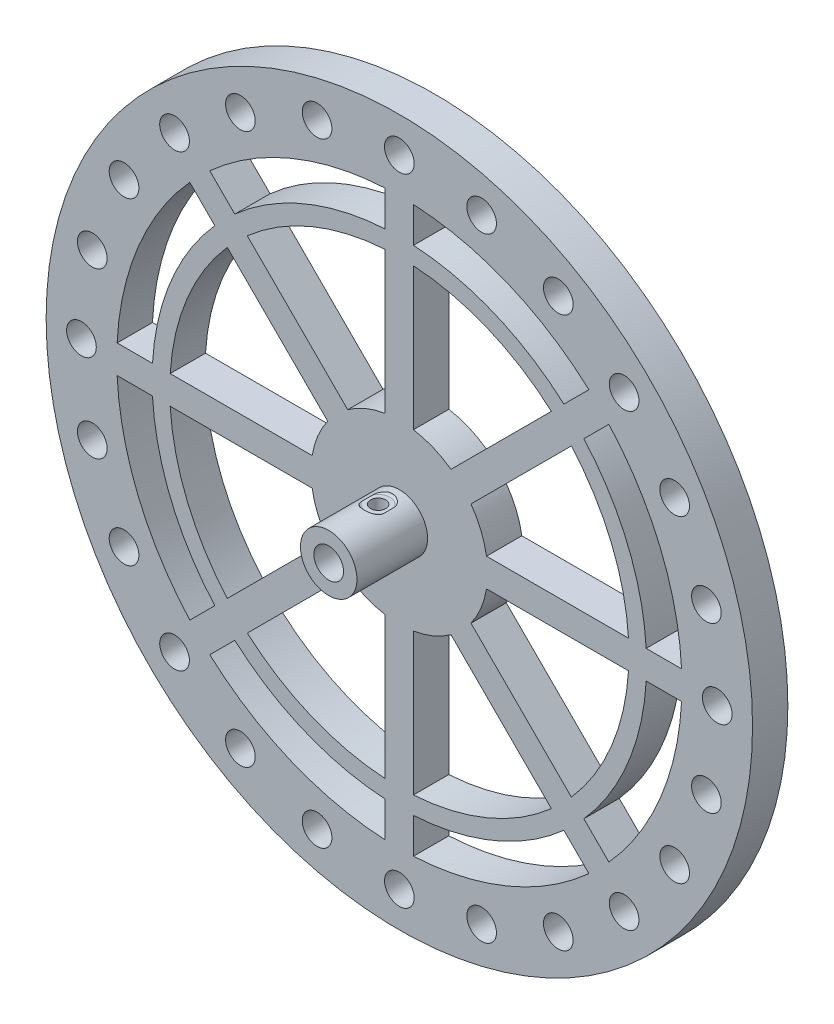
from build123d import *

# Parameters (mm, degrees)
SKETCH1_R            = 50
EXTRUDE2_DEPTH       = 2.5
EXTRUDE3_DEPTH       = 71.887234394
EXTRUDE3_DEPTH_BACK  = 71.887234394
SKETCH2_R            = 2.1
SKETCH3_R            = 4
EXTRUDE4_DEPTH       = 10
EXTRUDE5_REACH       = 74.284
SKETCH4_R            = 2.1
EXTRUDE6_REACH       = 76.648
EXTRUDE6_END_RADIUS  = 2.1
SKETCH5_R            = 1.075
SKETCH6_R            = 2
EXTRUDE7_DEPTH       = 0.3
FILLET1_R            = 0.3
FILLET1_OF_MIRROR2_R = 0.3


with BuildPart() as part:
    # Sketch1 → Extrude2 (new, symmetric)
    with BuildSketch(Plane.XY):
        Circle(SKETCH1_R)
        with BuildLine():
            Line((-2, 39.949968711), (-2, 34.942810419))
            ThreePointArc((-2, 34.942810419), (-13.393920133, 32.335783638), (-23.294084639, 26.122511764))
            Line((-23.294084639, 26.122511764), (-26.834680221, 29.663107346))
            ThreePointArc((-26.834680221, 29.663107346), (-15.307337295, 36.9551813), (-2, 39.949968711))
        make_face(mode=Mode.SUBTRACT)
        with BuildLine():
            Line((2, 34.942810419), (2, 39.949968711))
            ThreePointArc((2, 39.949968711), (15.307337295, 36.9551813), (26.834680221, 29.663107346))
            Line((26.834680221, 29.663107346), (23.294084639, 26.122511764))
            ThreePointArc((23.294084639, 26.122511764), (13.393920133, 32.335783638), (2, 34.942810419))
        make_face(mode=Mode.SUBTRACT)
        with BuildLine():
            Line((-29.663107346, 26.834680221), (-26.122511764, 23.294084639))
            ThreePointArc((-26.122511764, 23.294084639), (-32.335783638, 13.393920133), (-34.942810419, 2))
            Line((-34.942810419, 2), (-39.949968711, 2))
            ThreePointArc((-39.949968711, 2), (-36.9551813, 15.307337295), (-29.663107346, 26.834680221))
        make_face(mode=Mode.SUBTRACT)
        with BuildLine():
            Line((26.122511764, 23.294084639), (29.663107346, 26.834680221))
            ThreePointArc((29.663107346, 26.834680221), (36.9551813, 15.307337295), (39.949968711, 2))
            Line((39.949968711, 2), (34.942810419, 2))
            ThreePointArc((34.942810419, 2), (32.335783638, 13.393920133), (26.122511764, 23.294084639))
        make_face(mode=Mode.SUBTRACT)
        with BuildLine():
            Line((-39.949968711, -2), (-34.942810419, -2))
            ThreePointArc((-34.942810419, -2), (-32.335783638, -13.393920133), (-26.122511764, -23.294084639))
            Line((-26.122511764, -23.294084639), (-29.663107346, -26.834680221))
            ThreePointArc((-29.663107346, -26.834680221), (-36.9551813, -15.307337295), (-39.949968711, -2))
        make_face(mode=Mode.SUBTRACT)
        with BuildLine():
            Line((34.942810419, -2), (39.949968711, -2))
            ThreePointArc((39.949968711, -2), (36.9551813, -15.307337295), (29.663107346, -26.834680221))
            Line((29.663107346, -26.834680221), (26.122511764, -23.294084639))
            ThreePointArc((26.122511764, -23.294084639), (32.335783638, -13.393920133), (34.942810419, -2))
        make_face(mode=Mode.SUBTRACT)
        with BuildLine():
            Line((-26.834680221, -29.663107346), (-23.294084639, -26.122511764))
            ThreePointArc((-23.294084639, -26.122511764), (-13.393920133, -32.335783638), (-2, -34.942810419))
            Line((-2, -34.942810419), (-2, -39.949968711))
            ThreePointArc((-2, -39.949968711), (-15.307337295, -36.9551813), (-26.834680221, -29.663107346))
        make_face(mode=Mode.SUBTRACT)
        with BuildLine():
            Line((23.294084639, -26.122511764), (26.834680221, -29.663107346))
            ThreePointArc((26.834680221, -29.663107346), (15.307337295, -36.9551813), (2, -39.949968711))
            Line((2, -39.949968711), (2, -34.942810419))
            ThreePointArc((2, -34.942810419), (13.393920133, -32.335783638), (23.294084639, -26.122511764))
        make_face(mode=Mode.SUBTRACT)
        with BuildLine():
            ThreePointArc((-7.310750621, -10.139177746), (-4.783542905, -11.548494156), (-2, -12.338962679))
            Line((-2, -12.338962679), (-2, -32.438403167))
            ThreePointArc((-2, -32.438403167), (-12.437211552, -30.026084807), (-21.523201288, -24.351628412))
            Line((-21.523201288, -24.351628412), (-7.310750621, -10.139177746))
        make_face(mode=Mode.SUBTRACT)
        with BuildLine():
            ThreePointArc((-12.338962679, -2), (-11.548494156, -4.783542905), (-10.139177746, -7.310750621))
            Line((-10.139177746, -7.310750621), (-24.351628412, -21.523201288))
            ThreePointArc((-24.351628412, -21.523201288), (-30.026084807, -12.437211552), (-32.438403167, -2))
            Line((-32.438403167, -2), (-12.338962679, -2))
        make_face(mode=Mode.SUBTRACT)
        with BuildLine():
            ThreePointArc((21.523201288, -24.351628412), (12.437211552, -30.026084807), (2, -32.438403167))
            Line((2, -32.438403167), (2, -12.338962679))
            ThreePointArc((2, -12.338962679), (4.783542905, -11.548494156), (7.310750621, -10.139177746))
            Line((7.310750621, -10.139177746), (21.523201288, -24.351628412))
        make_face(mode=Mode.SUBTRACT)
        with BuildLine():
            ThreePointArc((32.438403167, -2), (30.026084807, -12.437211552), (24.351628412, -21.523201288))
            Line((24.351628412, -21.523201288), (10.139177746, -7.310750621))
            ThreePointArc((10.139177746, -7.310750621), (11.548494156, -4.783542905), (12.338962679, -2))
            Line((12.338962679, -2), (32.438403167, -2))
        make_face(mode=Mode.SUBTRACT)
        with BuildLine():
            ThreePointArc((-10.139177746, 7.310750621), (-11.548494156, 4.783542905), (-12.338962679, 2))
            Line((-12.338962679, 2), (-32.438403167, 2))
            ThreePointArc((-32.438403167, 2), (-30.026084807, 12.437211552), (-24.351628412, 21.523201288))
            Line((-24.351628412, 21.523201288), (-10.139177746, 7.310750621))
        make_face(mode=Mode.SUBTRACT)
        with BuildLine():
            ThreePointArc((-2, 12.338962679), (-4.783542905, 11.548494156), (-7.310750621, 10.139177746))
            Line((-7.310750621, 10.139177746), (-21.523201288, 24.351628412))
            ThreePointArc((-21.523201288, 24.351628412), (-12.437211552, 30.026084807), (-2, 32.438403167))
            Line((-2, 32.438403167), (-2, 12.338962679))
        make_face(mode=Mode.SUBTRACT)
        with BuildLine():
            ThreePointArc((24.351628412, 21.523201288), (30.026084807, 12.437211552), (32.438403167, 2))
            Line((32.438403167, 2), (12.338962679, 2))
            ThreePointArc((12.338962679, 2), (11.548494156, 4.783542905), (10.139177746, 7.310750621))
            Line((10.139177746, 7.310750621), (24.351628412, 21.523201288))
        make_face(mode=Mode.SUBTRACT)
        with BuildLine():
            ThreePointArc((2, 32.438403167), (12.437211552, 30.026084807), (21.523201288, 24.351628412))
            Line((21.523201288, 24.351628412), (7.310750621, 10.139177746))
            ThreePointArc((7.310750621, 10.139177746), (4.783542905, 11.548494156), (2, 12.338962679))
            Line((2, 12.338962679), (2, 32.438403167))
        make_face(mode=Mode.SUBTRACT)
    extrude(amount=EXTRUDE2_DEPTH, both=True)

    # Sketch2 → Extrude3 (cut, two sides: drawn at the far end of the back side and taken through both)
    with BuildSketch(Plane.XY.offset(2.5).offset(-EXTRUDE3_DEPTH_BACK)):
        with Locations((0, 45)):
            Circle(SKETCH2_R)
        with Locations((11.64685703, 43.466662183)):
            Circle(SKETCH2_R)
        with Locations((22.5, 38.97114317)):
            Circle(SKETCH2_R)
        with Locations((31.819805153, 31.819805153)):
            Circle(SKETCH2_R)
        with Locations((38.97114317, 22.5)):
            Circle(SKETCH2_R)
        with Locations((43.466662183, 11.64685703)):
            Circle(SKETCH2_R)
        with Locations((45, 0)):
            Circle(SKETCH2_R)
        with Locations((43.466662183, -11.64685703)):
            Circle(SKETCH2_R)
        with Locations((38.97114317, -22.5)):
            Circle(SKETCH2_R)
        with Locations((31.819805153, -31.819805153)):
            Circle(SKETCH2_R)
        with Locations((22.5, -38.97114317)):
            Circle(SKETCH2_R)
        with Locations((11.64685703, -43.466662183)):
            Circle(SKETCH2_R)
        with Locations((0, -45)):
            Circle(SKETCH2_R)
        with Locations((-11.64685703, -43.466662183)):
            Circle(SKETCH2_R)
        with Locations((-22.5, -38.97114317)):
            Circle(SKETCH2_R)
        with Locations((-31.819805153, -31.819805153)):
            Circle(SKETCH2_R)
        with Locations((-38.97114317, -22.5)):
            Circle(SKETCH2_R)
        with Locations((-43.466662183, -11.64685703)):
            Circle(SKETCH2_R)
        with Locations((-45, 0)):
            Circle(SKETCH2_R)
        with Locations((-43.466662183, 11.64685703)):
            Circle(SKETCH2_R)
        with Locations((-38.97114317, 22.5)):
            Circle(SKETCH2_R)
        with Locations((-31.819805153, 31.819805153)):
            Circle(SKETCH2_R)
        with Locations((-22.5, 38.97114317)):
            Circle(SKETCH2_R)
        with Locations((-11.64685703, 43.466662183)):
            Circle(SKETCH2_R)
    extrude(amount=EXTRUDE3_DEPTH + EXTRUDE3_DEPTH_BACK, mode=Mode.SUBTRACT)

    # Sketch3 → Extrude4 (add)
    with BuildSketch(Plane.XY.offset(2.5)):
        Circle(SKETCH3_R)
    extrude(amount=EXTRUDE4_DEPTH)

    # Sketch4 → Extrude5 (cut, up to next)
    with BuildSketch(Plane.XY.offset(12.5), mode=Mode.PRIVATE) as extrude5_sk1:
        Circle(SKETCH4_R)
    extrude5_tool1 = extrude(extrude5_sk1.sketch, amount=-EXTRUDE5_REACH, mode=Mode.PRIVATE) & part.part
    add(extrude5_tool1.solids().sort_by_distance((0, 0, 12.5))[0], mode=Mode.SUBTRACT)

    # Extrude6: up to this cylinder (the profile starts outside it)
    extrude6_end = Plane(origin=(0, 0, 5.5), z_dir=(0, 0, 1)) * Cylinder(EXTRUDE6_END_RADIUS, 158.496, mode=Mode.PRIVATE)
    # Sketch5 → Extrude6 (cut, up to the surface)
    with BuildSketch(Plane(origin=(0, 4, 0), x_dir=(1, 0, 0), z_dir=(0, 1, 0)), mode=Mode.PRIVATE) as extrude6_sk1:
        with Locations(Location((0, -5.5, 0), (0, 0, 180))):
            Circle(SKETCH5_R)
    extrude6_tool1 = extrude(extrude6_sk1.sketch, amount=-EXTRUDE6_REACH, mode=Mode.PRIVATE) - extrude6_end
    extrude6 = extrude6_tool1.solids().sort_by_distance((0, 4, 5.5))[0]
    add(extrude6, mode=Mode.SUBTRACT)

    # Sketch6 → Extrude7 (cut)
    with BuildSketch(Plane(origin=(0, 4, 0), x_dir=(1, 0, 0), z_dir=(0, 1, 0))):
        with Locations((0, -5.5)):
            Circle(SKETCH6_R)
    extrude7 = extrude(amount=-EXTRUDE7_DEPTH, mode=Mode.SUBTRACT)

    # Fillet1
    # the kernel refuses this fillet: 0.3 mm, written as the material it adds along each edge
    with BuildSketch(Plane(origin=(0, 3.7, 5.5), x_dir=(-0.9452611145674444, 0, 0.3263149173524141), z_dir=(-0.3263149173524141, 0, -0.9452611145674444))) as fillet1_piece_1_section:
        with BuildLine():
            CenterArc((2 - FILLET1_R, FILLET1_R), FILLET1_R, 270, 90)
            Line((2 - FILLET1_R, 0), (2, 0))
            Line((2, 0), (2, FILLET1_R))
        make_face()
    fillet1_piece_1 = revolve(axis=Axis((0, 3.7, 5.5), (0, 1, 0)), revolution_arc=141.909484198, mode=Mode.PRIVATE)
    fillet1_piece_1 = fillet1_piece_1 & Plane(origin=(0, 0, 7.415018409), x_dir=(1, 0, 0), z_dir=(0, 0, -1)) * Cylinder(4, 9, mode=Mode.PRIVATE)
    add(fillet1_piece_1)
    with BuildSketch(Plane(origin=(0, 3.7, 5.5), x_dir=(0.9452611145674441, 0, -0.32631491735241497), z_dir=(0.32631491735241497, 0, 0.9452611145674441))) as fillet1_piece_2_section:
        with BuildLine():
            CenterArc((2 - FILLET1_R, FILLET1_R), FILLET1_R, 270, 90)
            Line((2 - FILLET1_R, 0), (2, 0))
            Line((2, 0), (2, FILLET1_R))
        make_face()
    fillet1_piece_2 = revolve(axis=Axis((0, 3.7, 5.5), (0, 1, 0)), revolution_arc=141.909484198, mode=Mode.PRIVATE)
    fillet1_piece_2 = fillet1_piece_2 & Plane(origin=(0, 0, 3.584981591), x_dir=(1, 0, 0), z_dir=(0, 0, -1)) * Cylinder(4, 8, mode=Mode.PRIVATE)
    add(fillet1_piece_2)

    # Mirror2: Extrude6, Extrude7 across plane
    add(extrude6.mirror(Plane.ZX), mode=Mode.SUBTRACT)
    add(extrude7.mirror(Plane.ZX), mode=Mode.SUBTRACT)

    # Fillet1 of Mirror2
    # the kernel refuses this fillet: 0.3 mm, written as the material it adds along each edge
    with BuildSketch(Plane(origin=(0, -3.7, 5.5), x_dir=(-0.9452611145674444, 0, 0.3263149173524141), z_dir=(-0.3263149173524141, 0, -0.9452611145674444))) as fillet1_of_mirror2_piece_1_section:
        with BuildLine():
            CenterArc((2 - FILLET1_OF_MIRROR2_R, -FILLET1_OF_MIRROR2_R), FILLET1_OF_MIRROR2_R, 0, 90)
            Line((2, -FILLET1_OF_MIRROR2_R), (2, 0))
            Line((2, 0), (2 - FILLET1_OF_MIRROR2_R, 0))
        make_face()
    fillet1_of_mirror2_piece_1 = revolve(axis=Axis((0, -3.7, 5.5), (0, 1, 0)), revolution_arc=141.909484198, mode=Mode.PRIVATE)
    fillet1_of_mirror2_piece_1 = fillet1_of_mirror2_piece_1 & Plane(origin=(0, 0, 7.415018409), x_dir=(1, 0, 0), z_dir=(0, 0, -1)) * Cylinder(4, 9, mode=Mode.PRIVATE)
    add(fillet1_of_mirror2_piece_1)
    with BuildSketch(Plane(origin=(0, -3.7, 5.5), x_dir=(0.9452611145674441, 0, -0.32631491735241497), z_dir=(0.32631491735241497, 0, 0.9452611145674441))) as fillet1_of_mirror2_piece_2_section:
        with BuildLine():
            CenterArc((2 - FILLET1_OF_MIRROR2_R, -FILLET1_OF_MIRROR2_R), FILLET1_OF_MIRROR2_R, 0, 90)
            Line((2, -FILLET1_OF_MIRROR2_R), (2, 0))
            Line((2, 0), (2 - FILLET1_OF_MIRROR2_R, 0))
        make_face()
    fillet1_of_mirror2_piece_2 = revolve(axis=Axis((0, -3.7, 5.5), (0, 1, 0)), revolution_arc=141.909484198, mode=Mode.PRIVATE)
    fillet1_of_mirror2_piece_2 = fillet1_of_mirror2_piece_2 & Plane(origin=(0, 0, 3.584981591), x_dir=(1, 0, 0), z_dir=(0, 0, -1)) * Cylinder(4, 9, mode=Mode.PRIVATE)
    add(fillet1_of_mirror2_piece_2)


solid = part.part
